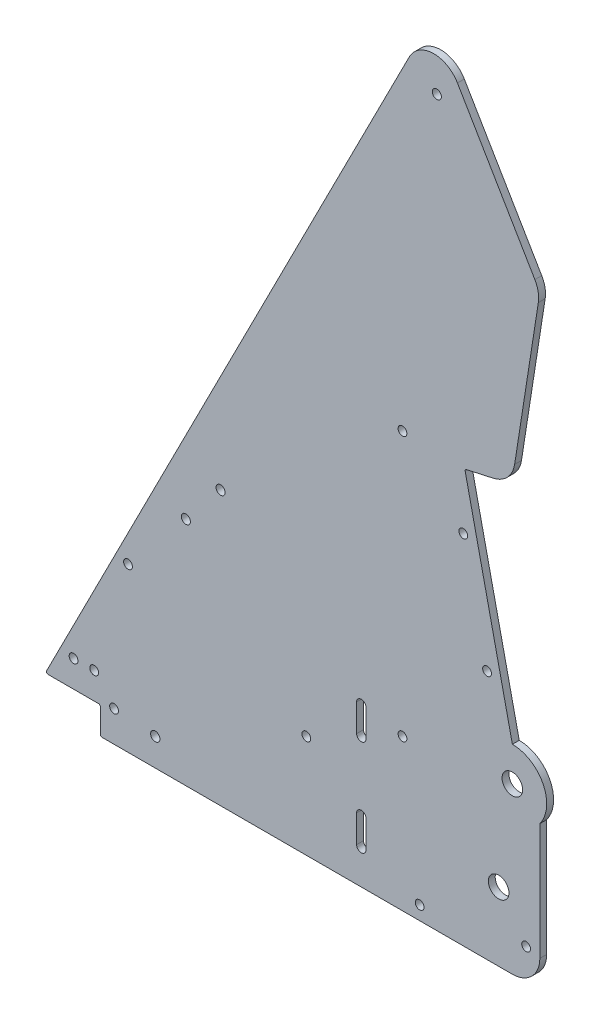
from build123d import *

# Parameters (mm, degrees)
BOSS_EXTRUDE1_DEPTH = 3.175
SKETCH2_R           = 2.0955
SKETCH2_R_2         = 2.032
SKETCH2_R_3         = 4.7625
CUT_EXTRUDE1_DEPTH  = 421.976111717
SKETCH7_R           = 2.159
CUT_EXTRUDE2_DEPTH  = 421.976111717
CUT_EXTRUDE3_REACH  = 422.976
SKETCH10_R          = 2.032
FILLET1_R           = 12.7
FILLET2_R           = 0.79375
SKETCH12_R          = 2.032
CUT_EXTRUDE5_DEPTH  = 410.593447353


with BuildPart() as part:
    # Sketch1 → Boss-Extrude1 (new body)
    with BuildSketch(Plane.XY):
        with BuildLine():
            Line((228.6, -12.7), (228.6, 53.975))
            ThreePointArc((228.6, 53.975), (230.099031657, 70.599515829), (215.9, 79.375))
            Line((215.9, 79.375), (193.909735224, 178.566674323))
            Line((193.909735224, 178.566674323), (215.607913982, 183.377044743))
            Line((215.607913982, 183.377044743), (228.6, 266.7))
            Line((228.6, 266.7), (178.754725958, 351.413083686))
            Line((178.754725958, 351.413083686), (0, 0))
            Line((0, 0), (25.4, 0))
            Line((25.4, 0), (25.4, -12.7))
            Line((25.4, -12.7), (228.6, -12.7))
        make_face()
    extrude(amount=BOSS_EXTRUDE1_DEPTH)

    # Sketch2 → Cut-Extrude1 (cut, through all)
    with BuildSketch(Plane.XY.offset(3.175)):
        with Locations((64.943150167, 94.057839899)):
            Circle(SKETCH2_R)
        with Locations((180.975, 322.164313376)):
            Circle(SKETCH2_R)
        with Locations((81.00705334, 113.73297687)):
            Circle(SKETCH2_R)
        with Locations((193.207821773, 152.394364194)):
            Circle(SKETCH2_R_2)
        with Locations((215.9, 63.5)):
            Circle(SKETCH2_R_3)
        with Locations((173.0375, -6.35)):
            Circle(SKETCH2_R_2)
        with Locations((204.202954161, 102.798527032)):
            Circle(SKETCH2_R_2)
        with Locations((209.55, 19.05)):
            Circle(SKETCH2_R_3)
        with Locations((165.1, 179.3875)):
            Circle(SKETCH2_R_2)
    extrude(amount=-CUT_EXTRUDE1_DEPTH, mode=Mode.SUBTRACT)

    # Sketch7 → Cut-Extrude2 (cut, through all)
    with BuildSketch(Plane.XY.offset(3.175)):
        with Locations((50.8, 0)):
            Circle(SKETCH7_R)
        with BuildLine():
            Line((143.891, 3.175), (143.891, 15.875))
            ThreePointArc((143.891, 15.875), (146.05, 18.034), (148.209, 15.875))
            Line((148.209, 15.875), (148.209, 3.175))
            ThreePointArc((148.209, 3.175), (146.05, 1.016), (143.891, 3.175))
        make_face()
        with BuildLine():
            Line((143.891, 47.625), (143.891, 60.325))
            ThreePointArc((143.891, 60.325), (146.05, 62.484), (148.209, 60.325))
            Line((148.209, 60.325), (148.209, 47.625))
            ThreePointArc((148.209, 47.625), (146.05, 45.466), (143.891, 47.625))
        make_face()
    extrude(amount=-CUT_EXTRUDE2_DEPTH, mode=Mode.SUBTRACT)

    # Sketch10 → Cut-Extrude3 (cut, up to next)
    with BuildSketch(Plane.XY.offset(3.175), mode=Mode.PRIVATE) as cut_extrude3_sk1:
        with Locations((165.1, 57.15)):
            Circle(SKETCH10_R)
    cut_extrude3_tool1 = extrude(cut_extrude3_sk1.sketch, amount=-CUT_EXTRUDE3_REACH, mode=Mode.PRIVATE) & part.part
    # Sketch10 → Cut-Extrude3 (cut, up to next)
    with BuildSketch(Plane.XY.offset(3.175), mode=Mode.PRIVATE) as cut_extrude3_sk2:
        with Locations((120.65, 34.925)):
            Circle(SKETCH10_R)
    cut_extrude3_tool2 = extrude(cut_extrude3_sk2.sketch, amount=-CUT_EXTRUDE3_REACH, mode=Mode.PRIVATE) & part.part
    # Sketch10 → Cut-Extrude3 (cut, up to next)
    with BuildSketch(Plane.XY.offset(3.175), mode=Mode.PRIVATE) as cut_extrude3_sk3:
        with Locations((13.046467246, 12.334704411)):
            Circle(SKETCH10_R)
    cut_extrude3_tool3 = extrude(cut_extrude3_sk3.sketch, amount=-CUT_EXTRUDE3_REACH, mode=Mode.PRIVATE) & part.part
    # Sketch10 → Cut-Extrude3 (cut, up to next)
    with BuildSketch(Plane.XY.offset(3.175), mode=Mode.PRIVATE) as cut_extrude3_sk4:
        with Locations((22.571467246, 12.334704411)):
            Circle(SKETCH10_R)
    cut_extrude3_tool4 = extrude(cut_extrude3_sk4.sketch, amount=-CUT_EXTRUDE3_REACH, mode=Mode.PRIVATE) & part.part
    # Sketch10 → Cut-Extrude3 (cut, up to next)
    with BuildSketch(Plane.XY.offset(3.175), mode=Mode.PRIVATE) as cut_extrude3_sk5:
        with Locations((38.211447917, 62.639810909)):
            Circle(SKETCH10_R)
    cut_extrude3_tool5 = extrude(cut_extrude3_sk5.sketch, amount=-CUT_EXTRUDE3_REACH, mode=Mode.PRIVATE) & part.part
    add(cut_extrude3_tool1.solids().sort_by_distance((165.1, 57.15, 3.175))[0], mode=Mode.SUBTRACT)
    add(cut_extrude3_tool2.solids().sort_by_distance((120.65, 34.925, 3.175))[0], mode=Mode.SUBTRACT)
    add(cut_extrude3_tool3.solids().sort_by_distance((13.046467, 12.334704, 3.175))[0], mode=Mode.SUBTRACT)
    add(cut_extrude3_tool4.solids().sort_by_distance((22.571467, 12.334704, 3.175))[0], mode=Mode.SUBTRACT)
    add(cut_extrude3_tool5.solids().sort_by_distance((38.211448, 62.639811, 3.175))[0], mode=Mode.SUBTRACT)

    # Fillet1
    fillet1_edges = [part.edges().sort_by_distance(p)[0] for p in [
        (228.6, -12.7, 1.5875),
        (178.754725958, 351.413083686, 1.5875),
        (215.607913982, 183.377044743, 1.5875),
        (228.6, 266.7, 1.5875),
    ]]
    fillet(fillet1_edges, radius=FILLET1_R)

    # Fillet2
    fillet2_edges = [part.edges().sort_by_distance(p)[0] for p in [
        (25.4, -12.7, 1.5875),
        (25.4, 0, 1.5875),
        (193.909735224, 178.566674323, 1.5875),
        (0, 0, 1.5875),
    ]]
    fillet(fillet2_edges, radius=FILLET2_R)

    # Sketch12 → Cut-Extrude5 (cut, through all)
    with BuildSketch(Plane.XY.offset(3.175)):
        with Locations((31.75, 1.5875)):
            Circle(SKETCH12_R)
        with Locations((222.25, 1.5875)):
            Circle(SKETCH12_R)
    extrude(amount=-CUT_EXTRUDE5_DEPTH, mode=Mode.SUBTRACT)


solid = part.part
